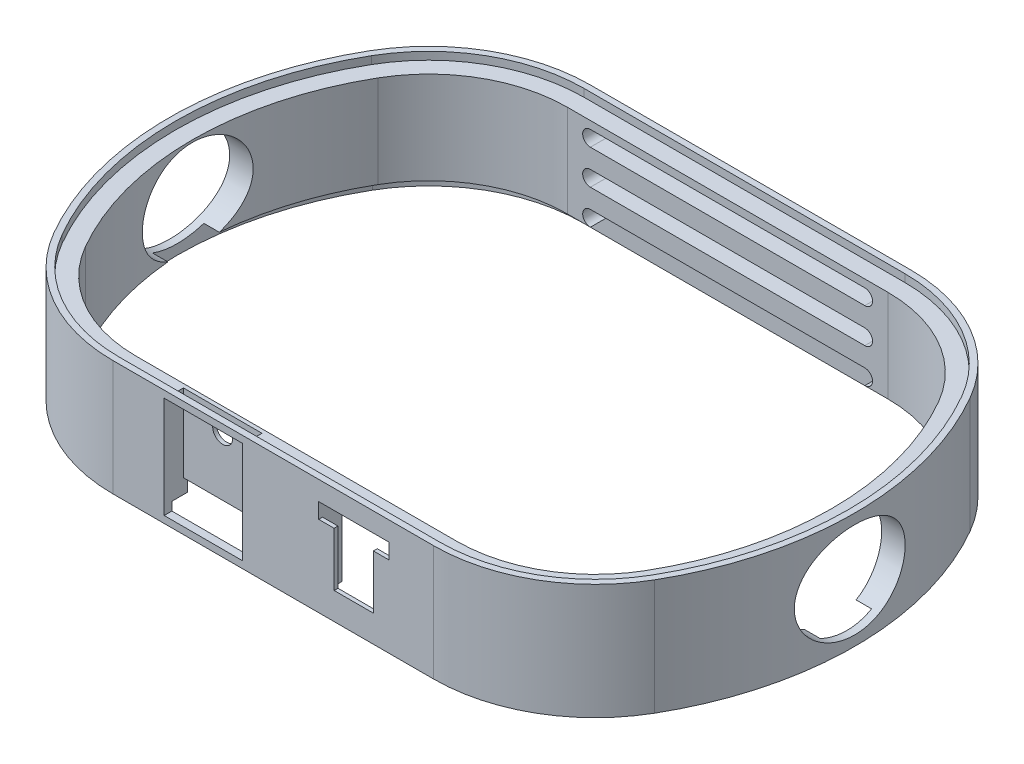
from build123d import *

# Parameters (mm, degrees)
SKETCH_1_W           = 89
SKETCH_1_H           = 62
EXTRUDE_1_DEPTH      = 15
CUT_EXTRUDE_START    = -15.000001
SKETCH_2_W           = 114.345269922
SKETCH_2_H           = 82.741202996
CUT_EXTRUDE_2_DEPTH  = 15.000002
CUT_EXTRUDE_3_REACH  = 70.225
CUT_EXTRUDE_6_REACH  = 84.425
SKETCH_4_W           = 9.1
SKETCH_4_H           = 11
FILLET_1_R           = 0.5
CUT_EXTRUDE_7_REACH  = 82.193
EXTRUDE_2_DEPTH      = 0.5
SKETCH_11_W          = 10.2
SKETCH_11_H          = 13.2
CUT_EXTRUDE_10_DEPTH = 2.5
SKETCH_12_R          = 1.3
SKETCH_12_W          = 10.2
SKETCH_12_H          = 3
CUT_EXTRUDE_11_DEPTH = 2.5
CUT_EXTRUDE_12_REACH = 84.425
CUT_EXTRUDE_START_2  = -52.200000102
CUT_EXTRUDE_13_DEPTH = 88.999999964
CUT_EXTRUDE_14_DEPTH = 1
CUT_EXTRUDE_15_DEPTH = 2


with BuildPart() as part:
    # 草图1 → 凸台-拉伸1 (new body)
    with BuildSketch(Plane(origin=(0, 0, 0), x_dir=(1, 0, 0), z_dir=(0, 1, 0))):
        with Locations((-7.7, -10.288888889)):
            Rectangle(SKETCH_1_W, SKETCH_1_H)
    extrude(amount=EXTRUDE_1_DEPTH)

    # 草图2 → 切除-拉伸2 (cut)
    with BuildSketch(Plane(origin=(0, 15, 0), x_dir=(1, 0, 0), z_dir=(0, 1, 0)).offset(CUT_EXTRUDE_START)):
        with Locations((-11.341983823, -7.488413354)):
            Rectangle(SKETCH_2_W, SKETCH_2_H)
        with BuildLine():
            Line((-28.520508076, 20.711111111), (13.120508076, 20.711111111))
            ThreePointArc((13.120508076, 20.711111111), (23.620508076, 17.897644591), (31.307041555, 10.211111111))
            ThreePointArc((31.307041555, 10.211111111), (36.8, -10.288888889), (31.307041555, -30.788888889))
            ThreePointArc((31.307041555, -30.788888889), (23.620508076, -38.475422368), (13.120508076, -41.288888889))
            Line((13.120508076, -41.288888889), (-28.520508076, -41.288888889))
            ThreePointArc((-28.520508076, -41.288888889), (-39.020508076, -38.475422368), (-46.707041555, -30.788888889))
            ThreePointArc((-46.707041555, -30.788888889), (-52.2, -10.288888889), (-46.707041555, 10.211111111))
            ThreePointArc((-46.707041555, 10.211111111), (-39.020508076, 17.897644591), (-28.520508076, 20.711111111))
        make_face(mode=Mode.SUBTRACT)
    extrude(amount=CUT_EXTRUDE_2_DEPTH, mode=Mode.SUBTRACT)

    # 草图3 → 切除-拉伸3 (cut, up to next)
    with BuildSketch(Plane(origin=(0, 15, 0), x_dir=(1, 0, 0), z_dir=(0, 1, 0)), mode=Mode.PRIVATE) as cut_extrude_3_sk1:
        with BuildLine():
            Line((-28.520508076, -38.288888889), (13.120508076, -38.288888889))
            ThreePointArc((13.120508076, -38.288888889), (22.120508076, -35.877346157), (28.708965344, -29.288888889))
            ThreePointArc((28.708965344, -29.288888889), (33.8, -10.288888889), (28.708965344, 8.711111111))
            ThreePointArc((28.708965344, 8.711111111), (22.120508076, 15.299568379), (13.120508076, 17.711111111))
            Line((13.120508076, 17.711111111), (-28.520508076, 17.711111111))
            ThreePointArc((-28.520508076, 17.711111111), (-37.520508076, 15.299568379), (-44.108965344, 8.711111111))
            ThreePointArc((-44.108965344, 8.711111111), (-49.2, -10.288888889), (-44.108965344, -29.288888889))
            ThreePointArc((-44.108965344, -29.288888889), (-37.520508076, -35.877346157), (-28.520508076, -38.288888889))
        make_face()
    cut_extrude_3_tool1 = extrude(cut_extrude_3_sk1.sketch, amount=-CUT_EXTRUDE_3_REACH, mode=Mode.PRIVATE) & part.part
    add(cut_extrude_3_tool1.solids().sort_by_distance((-7.7, 15, 10.288889))[0], mode=Mode.SUBTRACT)

    # 草图4 → 切除-拉伸6 (cut, up to next)
    with BuildSketch(Plane.XY.offset(41.288888889), mode=Mode.PRIVATE) as cut_extrude_6_sk1:
        with Locations((2.75, 7)):
            Rectangle(SKETCH_4_W, SKETCH_4_H)
    cut_extrude_6_tool1 = extrude(cut_extrude_6_sk1.sketch, amount=-CUT_EXTRUDE_6_REACH, mode=Mode.PRIVATE) & part.part
    add(cut_extrude_6_tool1.solids().sort_by_distance((2.75, 7, 41.288889))[0], mode=Mode.SUBTRACT)

    # 圆角1
    fillet_1_edges = [part.edges().sort_by_distance(p)[0] for p in [
        (7.3, 1.5, 39.788888889),
    ]]
    fillet(fillet_1_edges, radius=FILLET_1_R)

    # 草图7 → 切除-拉伸7 (cut, up to next)
    with BuildSketch(Plane(origin=(0, 0, 38.288888889), x_dir=(-1, 0, 0), z_dir=(0, 0, -1)), mode=Mode.PRIVATE) as cut_extrude_7_sk1:
        Polygon((-7.3, 2.914213562), (-5.885786438, 1.5), (-6.946446609, 0.439339828), (-8.360660172, 1.853553391), align=None)
    cut_extrude_7_tool1 = extrude(cut_extrude_7_sk1.sketch, amount=-CUT_EXTRUDE_7_REACH, mode=Mode.PRIVATE) & part.part
    add(cut_extrude_7_tool1.solids().sort_by_distance((7.123223, 1.676777, 38.288889))[0], mode=Mode.SUBTRACT)

    # 草图8 → 凸台-拉伸2 (add)
    with BuildSketch(Plane.XY.offset(41.288888889)):
        Polygon((-1.8, 1.5), (-1.8, 0), (10.425334972, 0), (10.425334972, 10.5), (7.3, 10.5), (5.3, 10.5), (5.3, 3.5), (0.2, 3.5), (0.2, 10.5), (-1.8, 10.5), align=None)
    extrude(amount=-EXTRUDE_2_DEPTH)

    # 草图11 → 切除-拉伸10 (cut)
    with BuildSketch(Plane.XY.offset(41.288888889)):
        with Locations((-16.770478922, 7.5)):
            Rectangle(SKETCH_11_W, SKETCH_11_H)
    extrude(amount=-CUT_EXTRUDE_10_DEPTH, mode=Mode.SUBTRACT)

    # 草图12 → 切除-拉伸11 (cut)
    with BuildSketch(Plane.XY.offset(38.788888889)):
        with Locations((-16.770478922, 11.5)):
            Circle(SKETCH_12_R)
        with Locations((-16.770478922, 2.4)):
            Rectangle(SKETCH_12_W, SKETCH_12_H)
    extrude(amount=-CUT_EXTRUDE_11_DEPTH, mode=Mode.SUBTRACT)

    # 草图13 → 切除-拉伸12 (cut, up to next)
    with BuildSketch(Plane(origin=(0, 0, -20.711111111), x_dir=(-1, 0, 0), z_dir=(0, 0, -1)), mode=Mode.PRIVATE) as cut_extrude_12_sk1:
        with BuildLine():
            Line((-10.120508076, 13), (25.520508076, 13))
            ThreePointArc((25.520508076, 13), (26.520508076, 12), (25.520508076, 11))
            Line((25.520508076, 11), (-10.120508076, 11))
            ThreePointArc((-10.120508076, 11), (-11.120508076, 12), (-10.120508076, 13))
        make_face()
    cut_extrude_12_tool1 = extrude(cut_extrude_12_sk1.sketch, amount=-CUT_EXTRUDE_12_REACH, mode=Mode.PRIVATE) & part.part
    # 草图13 → 切除-拉伸12 (cut, up to next)
    with BuildSketch(Plane(origin=(0, 0, -20.711111111), x_dir=(-1, 0, 0), z_dir=(0, 0, -1)), mode=Mode.PRIVATE) as cut_extrude_12_sk2:
        with BuildLine():
            Line((-10.120508076, 6.5), (25.520508076, 6.5))
            ThreePointArc((25.520508076, 6.5), (26.520508076, 7.5), (25.520508076, 8.5))
            Line((25.520508076, 8.5), (-10.120508076, 8.5))
            ThreePointArc((-10.120508076, 8.5), (-11.120508076, 7.5), (-10.120508076, 6.5))
        make_face()
    cut_extrude_12_tool2 = extrude(cut_extrude_12_sk2.sketch, amount=-CUT_EXTRUDE_12_REACH, mode=Mode.PRIVATE) & part.part
    # 草图13 → 切除-拉伸12 (cut, up to next)
    with BuildSketch(Plane(origin=(0, 0, -20.711111111), x_dir=(-1, 0, 0), z_dir=(0, 0, -1)), mode=Mode.PRIVATE) as cut_extrude_12_sk3:
        with BuildLine():
            Line((-10.120508076, 2), (25.520508076, 2))
            ThreePointArc((25.520508076, 2), (26.520508076, 3), (25.520508076, 4))
            Line((25.520508076, 4), (-10.120508076, 4))
            ThreePointArc((-10.120508076, 4), (-11.120508076, 3), (-10.120508076, 2))
        make_face()
    cut_extrude_12_tool3 = extrude(cut_extrude_12_sk3.sketch, amount=-CUT_EXTRUDE_12_REACH, mode=Mode.PRIVATE) & part.part
    add(cut_extrude_12_tool1.solids().sort_by_distance((-7.7, 12, -20.711111))[0], mode=Mode.SUBTRACT)
    add(cut_extrude_12_tool2.solids().sort_by_distance((-7.7, 7.5, -20.711111))[0], mode=Mode.SUBTRACT)
    add(cut_extrude_12_tool3.solids().sort_by_distance((-7.7, 3, -20.711111))[0], mode=Mode.SUBTRACT)

    # 切除-拉伸13: read off the stored shape, not the designer's step
    # 切除-拉伸13 outline → 切除-拉伸13 (cut)
    with BuildSketch(Plane(origin=(0, 0, 0), x_dir=(0, 0, -1), z_dir=(1, 0, 0)).offset(CUT_EXTRUDE_START_2)):
        with BuildLine():
            add(Edge.make_bspline(
                [(-17.488888889, 7.5), (-17.488888889, 6.618712307), (-17.038806778, 4.85613692), (-15.30252013, 2.82180753), (-12.943624098, 1.578601929), (-10.288888889, 1.160699036), (-7.634153679, 1.578601929), (-5.275257648, 2.82180753), (-3.538970999, 4.85613692), (-2.863847834, 7.5), (-3.538970999, 10.14386308), (-5.275257648, 12.17819247), (-7.634153679, 13.421398071), (-10.288888889, 13.839300964), (-12.943624098, 13.421398071), (-15.30252013, 12.17819247), (-17.038806778, 10.14386308), (-17.488888889, 8.381287693), (-17.488888889, 7.5)],
                knots=[0, 0, 0, 0, 0.392699082, 0.785398163, 1.178097245, 1.570796327, 1.963495408, 2.35619449, 2.748893572, 3.141592654, 3.534291735, 3.926990817, 4.319689899, 4.71238898, 5.105088062, 5.497787144, 5.890486225, 6.283185307, 6.283185307, 6.283185307, 6.283185307], degree=3))
        make_face()
    extrude(amount=CUT_EXTRUDE_13_DEPTH, mode=Mode.SUBTRACT)

    # 草图15 → 切除-拉伸14 (cut)
    with BuildSketch(Plane(origin=(0, 15, 0), x_dir=(1, 0, 0), z_dir=(0, 1, 0))):
        with BuildLine():
            Line((13.120508076, 19.911111111), (-28.520508076, 19.911111111))
            ThreePointArc((-28.520508076, 19.911111111), (-38.620508076, 17.204824268), (-46.014221232, 9.811111111))
            ThreePointArc((-46.014221232, 9.811111111), (-51.4, -10.288888889), (-46.014221232, -30.388888889))
            ThreePointArc((-46.014221232, -30.388888889), (-38.620508076, -37.782602045), (-28.520508076, -40.488888889))
            Line((-28.520508076, -40.488888889), (13.120508076, -40.488888889))
            ThreePointArc((13.120508076, -40.488888889), (23.220508076, -37.782602045), (30.614221232, -30.388888889))
            ThreePointArc((30.614221232, -30.388888889), (36, -10.288888889), (30.614221232, 9.811111111))
            ThreePointArc((30.614221232, 9.811111111), (23.220508076, 17.204824268), (13.120508076, 19.911111111))
        make_face()
    extrude(amount=-CUT_EXTRUDE_14_DEPTH, mode=Mode.SUBTRACT)

    # 草图16 → 切除-拉伸15 (cut)
    with BuildSketch(Plane.XZ):
        with BuildLine():
            Line((-28.520508076, -19.711111111), (13.120508076, -19.711111111))
            ThreePointArc((13.120508076, -19.711111111), (23.120508076, -17.031619187), (30.441016151, -9.711111111))
            ThreePointArc((30.441016151, -9.711111111), (35.8, 10.288888889), (30.441016151, 30.288888889))
            ThreePointArc((30.441016151, 30.288888889), (23.120508076, 37.609396965), (13.120508076, 40.288888889))
            Line((13.120508076, 40.288888889), (-28.520508076, 40.288888889))
            ThreePointArc((-28.520508076, 40.288888889), (-38.520508076, 37.609396965), (-45.841016151, 30.288888889))
            ThreePointArc((-45.841016151, 30.288888889), (-51.2, 10.288888889), (-45.841016151, -9.711111111))
            ThreePointArc((-45.841016151, -9.711111111), (-38.520508076, -17.031619187), (-28.520508076, -19.711111111))
        make_face()
    extrude(amount=-CUT_EXTRUDE_15_DEPTH, mode=Mode.SUBTRACT)


solid = part.part
